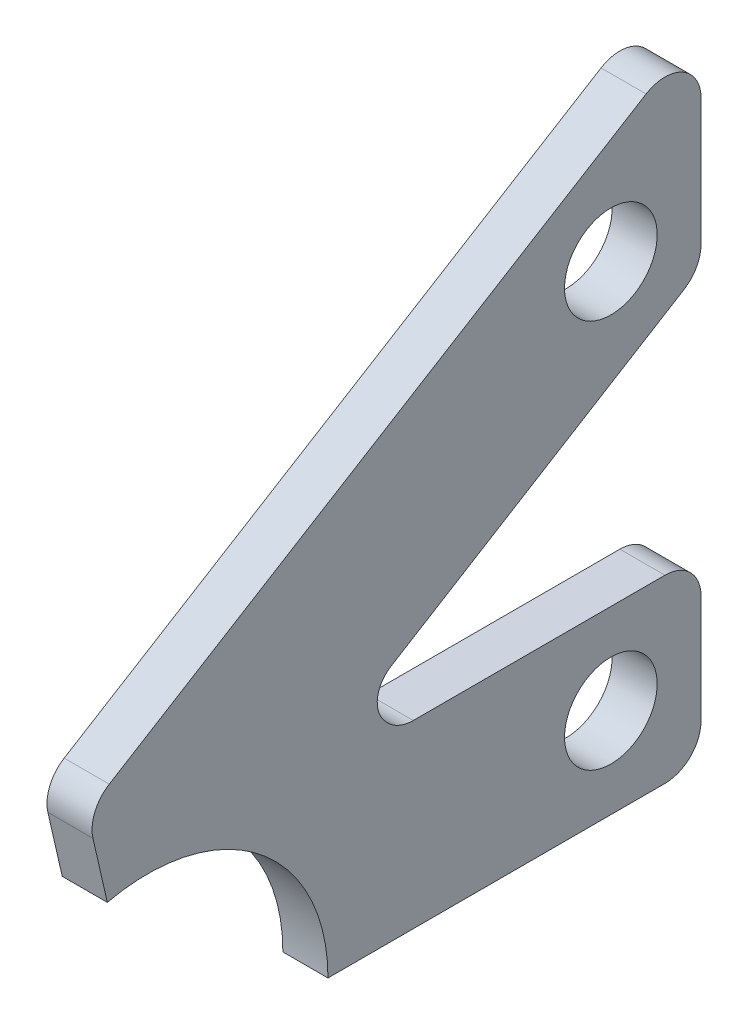
from build123d import *

# Parameters (mm, degrees)
SKETCH2_R           = 3.2639
BOSS_EXTRUDE1_DEPTH = 3.175


with BuildPart() as part:
    # Sketch2 → Boss-Extrude1 (new body)
    with BuildSketch(Plane(origin=(-112.555, 0, -573.58969557), x_dir=(0, 0.6231241879767124, 0.7821229100073485), z_dir=(-1, 0, 0))):
        with BuildLine():
            Line((845.771780124, 136.999641403), (864.330586832, 122.213677187))
            ThreePointArc((864.330586832, 122.213677187), (874.263547789, 127), (884.196508746, 122.213677187))
            Line((884.196508746, 122.213677187), (887.735832346, 125.033487368))
            ThreePointArc((887.735832346, 125.033487368), (888.597587529, 126.330104481), (888.540958266, 127.885942216))
            Line((888.540958266, 127.885942216), (873.423706379, 169.576043207))
            ThreePointArc((873.423706379, 169.576043207), (871.446613669, 171.216745754), (869.04925283, 170.292915988))
            Line((869.04925283, 170.292915988), (863.47898249, 163.301314423))
            ThreePointArc((863.47898249, 163.301314423), (862.959009478, 162.129347633), (863.077713324, 160.852716328))
            Line((863.077713324, 160.852716328), (871.323924882, 138.111453883))
            ThreePointArc((871.323924882, 138.111453883), (871.188959814, 136.430204891), (869.830832527, 135.430052896))
            ThreePointArc((869.830832527, 135.430052896), (869.749583246, 135.412845003), (869.668400761, 135.39532469))
            ThreePointArc((869.668400761, 135.39532469), (868.550892206, 135.403510223), (867.545059791, 135.890535404))
            Line((867.545059791, 135.890535404), (853.685457311, 146.932602361))
            ThreePointArc((853.685457311, 146.932602361), (851.817152024, 147.46990594), (850.116129682, 146.528745607))
            Line((850.116129682, 146.528745607), (845.36792337, 140.568969032))
            ThreePointArc((845.36792337, 140.568969032), (844.830619791, 138.700663745), (845.771780124, 136.999641403))
        make_face()
        with Locations((852.708507005, 139.592018726)):
            Circle(SKETCH2_R, mode=Mode.SUBTRACT)
        with Locations((869.774365973, 161.012466745)):
            Circle(SKETCH2_R, mode=Mode.SUBTRACT)
    extrude(amount=BOSS_EXTRUDE1_DEPTH)


solid = part.part
